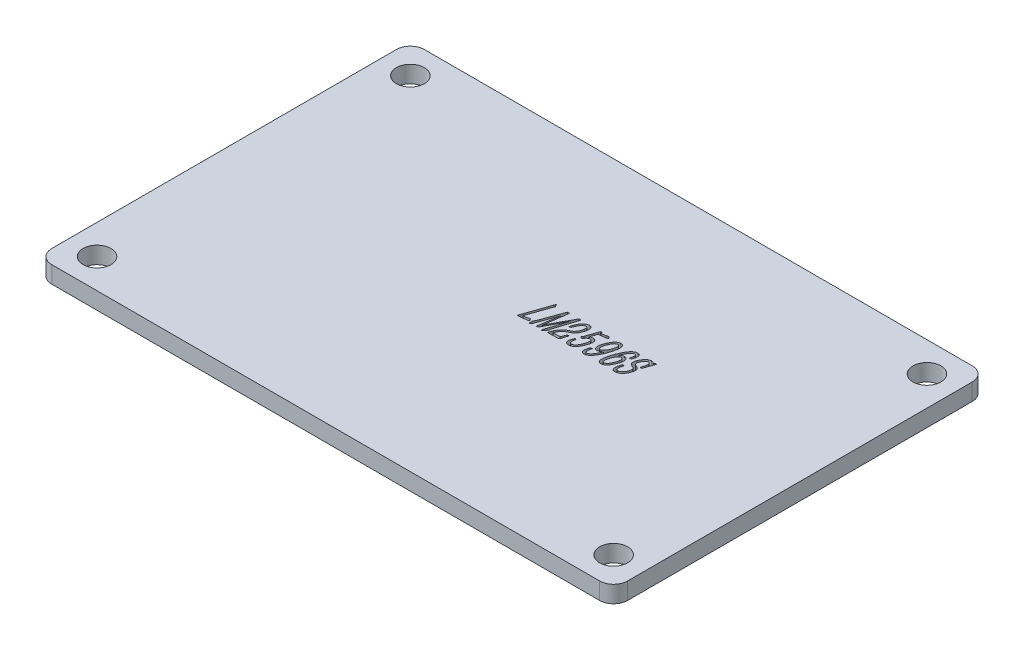
from build123d import *

# Parameters (mm, degrees)
SKETCH_1_R          = 1.65
EXTRUDE_1_DEPTH     = 2
CUT_EXTRUDE_START   = -1
CUT_EXTRUDE_1_DEPTH = 1


# Read off the part's stored shape, not the designer's step: 切除-拉伸1
with BuildPart() as part:
    # 草图1 → 凸台-拉伸1 (new body)
    with BuildSketch(Plane(origin=(0, 0, 0), x_dir=(1, 0, 0), z_dir=(0, 1, 0))):
        with BuildLine():
            Line((32.35, -22), (-32.35, -22))
            ThreePointArc((-32.35, -22), (-33.516726189, -21.516726189), (-34, -20.35))
            Line((-34, -20.35), (-34, 20.35))
            ThreePointArc((-34, 20.35), (-33.516726189, 21.516726189), (-32.35, 22))
            Line((-32.35, 22), (32.35, 22))
            ThreePointArc((32.35, 22), (33.516726189, 21.516726189), (34, 20.35))
            Line((34, 20.35), (34, -20.35))
            ThreePointArc((34, -20.35), (33.516726189, -21.516726189), (32.35, -22))
        make_face()
        with Locations(Location((-30.5, 18.5, 0), (0, 0, 270))):
            Circle(SKETCH_1_R, mode=Mode.SUBTRACT)
        with Locations(Location((30.5, 18.5, 0), (0, 0, 90))):
            Circle(SKETCH_1_R, mode=Mode.SUBTRACT)
        with Locations(Location((30.5, -18.5, 0), (0, 0, 270))):
            Circle(SKETCH_1_R, mode=Mode.SUBTRACT)
        with Locations(Location((-30.5, -18.5, 0), (0, 0, 90))):
            Circle(SKETCH_1_R, mode=Mode.SUBTRACT)
    extrude(amount=EXTRUDE_1_DEPTH)

    # 切除-拉伸1 outline → 切除-拉伸1 (cut)
    # profile 1 of 7: a face of its own
    with BuildSketch(Plane(origin=(0, 2, 0), x_dir=(1, 0, 0), z_dir=(0, 1, 0)).offset(CUT_EXTRUDE_START)):
        with BuildLine():
            add(Edge.make_bspline(
                [(11.319624973, 2.529725123), (11.326753338, 2.567830624), (11.339981513, 2.638543373), (11.363810052, 2.738810386), (11.386747264, 2.83309971), (11.402493277, 2.928406503), (11.408788686, 3.024022456), (11.40107061, 3.101456515), (11.384715065, 3.156938358), (11.369804851, 3.194089384), (11.348293758, 3.225207318), (11.322963493, 3.250684221), (11.294296694, 3.270288272), (11.263524636, 3.284015152), (11.230211949, 3.291074833), (11.184684427, 3.290006717), (11.129135658, 3.280496298), (11.076013715, 3.25837237), (11.034406929, 3.229718869), (10.996101664, 3.199008787), (10.95262477, 3.156252878), (10.901523079, 3.105345591), (10.847119389, 3.043543935), (10.792558439, 2.971198575), (10.736915044, 2.889534868), (10.664019856, 2.766635878), (10.576158329, 2.602847504), (10.499771775, 2.433051534), (10.445727973, 2.301323215), (10.421585689, 2.239116022), (10.410345271, 2.210525074)],
                knots=[0, 0, 0, 0, 0.048016888, 0.089105405, 0.127654772, 0.168210064, 0.208611881, 0.246125029, 0.263765638, 0.280183723, 0.295474126, 0.310282398, 0.324462469, 0.338252576, 0.351782306, 0.366256964, 0.394408992, 0.421179489, 0.436725185, 0.456877911, 0.481929832, 0.512200465, 0.546242109, 0.583815889, 0.624389886, 0.668597469, 0.76077153, 0.854490538, 0.899099648, 0.93715592, 0.93715592, 0.93715592, 0.93715592], degree=3))
            Line((11.319624973, 2.529725123), (11.486682293, 2.553590454))
            Line((11.486682293, 2.553590454), (11.542616663, 2.577455785))
            Line((11.542616663, 2.577455785), (11.59705945, 2.735563605))
            add(Edge.make_bspline(
                [(11.300980183, 3.558171745), (11.332938296, 3.55537961), (11.391604224, 3.55025405), (11.470752634, 3.530082967), (11.533066183, 3.499358127), (11.576123996, 3.457009642), (11.604543879, 3.412414193), (11.628279189, 3.371220088), (11.645918441, 3.332653625), (11.656575541, 3.294841352), (11.663922251, 3.255421395), (11.665904063, 3.210409655), (11.667264725, 3.158391127), (11.663279952, 3.101732242), (11.660194196, 3.045264039), (11.655589125, 2.993299452), (11.650667761, 2.948240187), (11.642153035, 2.894323663), (11.626748851, 2.823432882), (11.607663016, 2.766946106), (11.59705945, 2.735563605)],
                knots=[0, 0, 0, 0, 0.091586168, 0.168125935, 0.232336966, 0.287622003, 0.338278218, 0.383145194, 0.423552602, 0.459085297, 0.495189033, 0.537922916, 0.587673765, 0.643887342, 0.700141333, 0.749361491, 0.792995872, 0.829682411, 0.905376226, 1, 1, 1, 1], degree=3))
            add(Edge.make_bspline(
                [(10.078627743, 2.088962284), (10.092043775, 2.124514194), (10.117212009, 2.191208933), (10.152737815, 2.284990134), (10.185663794, 2.365405537), (10.225197569, 2.458460171), (10.279164702, 2.571015442), (10.346529938, 2.7098071), (10.422825779, 2.84851108), (10.4891655, 2.962189864), (10.547655064, 3.05014134), (10.597371436, 3.11763489), (10.654008389, 3.186987801), (10.714203242, 3.258491084), (10.779252353, 3.326433394), (10.846166624, 3.388282473), (10.915212273, 3.440367594), (10.984767437, 3.48551032), (11.058000786, 3.520567517), (11.135394035, 3.544224908), (11.216917438, 3.558489113), (11.272581603, 3.55827896), (11.300980183, 3.558171745)],
                knots=[0, 0, 0, 0, 0.056410835, 0.105825706, 0.14886341, 0.185400755, 0.255897094, 0.334127727, 0.414387224, 0.490842857, 0.529430594, 0.571134342, 0.615225599, 0.662339254, 0.709844425, 0.754777107, 0.797439761, 0.838085033, 0.877703722, 0.91750761, 0.957914275, 1, 1, 1, 1], degree=3))
            add(Edge.make_bspline(
                [(10.220328148, 0.281909227), (10.19249915, 0.280098745), (10.138454152, 0.276582721), (10.070837234, 0.287224422), (10.020300058, 0.307853057), (9.981584961, 0.329435729), (9.942445068, 0.358703245), (9.902806204, 0.393420868), (9.86591267, 0.435175841), (9.837901593, 0.485120934), (9.814521026, 0.539843172), (9.797351744, 0.623039326), (9.785413991, 0.73268396), (9.780797995, 0.847487699), (9.785600824, 0.948152915), (9.796865384, 1.037662616), (9.813201733, 1.140700776), (9.835695491, 1.251967632), (9.860700878, 1.361489032), (9.881452444, 1.45999998), (9.901360112, 1.541057249), (9.921795449, 1.627581379), (9.950036536, 1.724331764), (9.987162506, 1.839703457), (10.030604097, 1.961317245), (10.06209135, 2.045009175), (10.078627743, 2.088962284)],
                knots=[0, 0, 0, 0, 0.03956068, 0.07682838, 0.095843058, 0.116866224, 0.139607214, 0.165118082, 0.191658894, 0.218244295, 0.246111869, 0.275832629, 0.33841793, 0.402715898, 0.438774703, 0.481433334, 0.530775575, 0.586935239, 0.642621152, 0.690341085, 0.729908068, 0.761166336, 0.816603174, 0.872993246, 0.933298924, 1, 1, 1, 1], degree=3))
            add(Edge.make_bspline(
                [(11.068293203, 1.084380993), (11.053872372, 1.05541355), (11.023329038, 0.994060479), (10.969919402, 0.900045656), (10.909148123, 0.797266792), (10.842698841, 0.689580228), (10.77067729, 0.585020153), (10.689912589, 0.496193855), (10.604071033, 0.425272911), (10.514549478, 0.373835141), (10.428409541, 0.337241697), (10.350739054, 0.30914977), (10.282885658, 0.289066112), (10.239814747, 0.284138589), (10.220328148, 0.281909227)],
                knots=[0, 0, 0, 0, 0.079263847, 0.167880907, 0.264814542, 0.371790082, 0.477921398, 0.575347443, 0.664953156, 0.749565857, 0.827301008, 0.893958514, 0.952023584, 1, 1, 1, 1], degree=3))
            add(Edge.make_bspline(
                [(10.866929469, 2.42158534), (10.886589109, 2.42118425), (10.924292828, 2.420415029), (10.978317607, 2.413823439), (11.027127036, 2.402341257), (11.0704245, 2.384465457), (11.110126107, 2.363025804), (11.145250427, 2.334657677), (11.177822239, 2.301762803), (11.206196623, 2.262416031), (11.230840866, 2.217275717), (11.251560663, 2.166182107), (11.268932178, 2.109090825), (11.285125994, 2.024054569), (11.296537056, 1.911174741), (11.289262569, 1.794565371), (11.274634537, 1.697461188), (11.256960519, 1.617881049), (11.23389369, 1.53225165), (11.19483815, 1.411518301), (11.141690833, 1.260480826), (11.092451101, 1.142342016), (11.068293203, 1.084380993)],
                knots=[0, 0, 0, 0, 0.036382012, 0.069774277, 0.100580197, 0.128866596, 0.156266865, 0.183794371, 0.212106964, 0.241746136, 0.273258923, 0.307101626, 0.343643368, 0.383535045, 0.467197852, 0.552918689, 0.598998486, 0.648914818, 0.703726948, 0.763108811, 0.883776925, 1, 1, 1, 1], degree=3))
            add(Edge.make_bspline(
                [(10.410345271, 2.210525074), (10.416050186, 2.215819905), (10.449129723, 2.245792172), (10.515387249, 2.296635031), (10.596944633, 2.34739101), (10.669961017, 2.38141985), (10.730958103, 2.401452348), (10.797361446, 2.414729849), (10.843260597, 2.419252922), (10.866929469, 2.42158534)],
                knots=[0.404971471, 0.404971471, 0.404971471, 0.404971471, 0.432023627, 0.560128766, 0.694717093, 0.765101066, 0.83971451, 0.917345382, 1, 1, 1, 1], degree=3))
        make_face()
        with BuildLine():
            add(Edge.make_bspline(
                [(10.78340081, 2.144150863), (10.773100017, 2.142556458), (10.750618648, 2.139076688), (10.716027357, 2.124014401), (10.676728769, 2.104229335), (10.61950773, 2.068122267), (10.549209543, 2.014286204), (10.485947564, 1.949276583), (10.438225331, 1.889966685), (10.402168059, 1.836055129), (10.362124324, 1.775401551), (10.32250004, 1.70543497), (10.282350459, 1.628120598), (10.242879966, 1.544201096), (10.20537119, 1.453333549), (10.182767084, 1.390009052), (10.171105902, 1.35734072)],
                knots=[0, 0, 0, 0, 0.030109941, 0.065714622, 0.108588335, 0.157792871, 0.261597461, 0.364557771, 0.419941904, 0.482122806, 0.552499195, 0.630638236, 0.715103682, 0.805067532, 0.89943673, 1, 1, 1, 1], degree=3))
            add(Edge.make_bspline(
                [(10.994459834, 1.706371191), (10.996023434, 1.727987763), (10.999094338, 1.770442601), (10.998155227, 1.83301138), (10.993304701, 1.893197713), (10.982810117, 1.949506966), (10.969352689, 2.000724278), (10.95159455, 2.044118522), (10.930889814, 2.079967855), (10.905013561, 2.106412307), (10.876785311, 2.125274258), (10.847149319, 2.138714329), (10.815442897, 2.144403173), (10.79410278, 2.144235134), (10.78340081, 2.144150863)],
                knots=[0, 0, 0, 0, 0.117814531, 0.231387145, 0.339957123, 0.445764662, 0.542521874, 0.627383564, 0.700188791, 0.766158301, 0.826528991, 0.884046869, 0.941850039, 1, 1, 1, 1], degree=3))
            add(Edge.make_bspline(
                [(10.261346687, 0.559343703), (10.277116988, 0.561036132), (10.310050452, 0.564570469), (10.359697313, 0.581371719), (10.411370211, 0.606364875), (10.464387545, 0.639656708), (10.516258175, 0.68049559), (10.566448783, 0.725344467), (10.611522599, 0.776372283), (10.667831669, 0.851112799), (10.731329902, 0.95619793), (10.795934626, 1.094643622), (10.855107472, 1.241413379), (10.915663077, 1.390752272), (10.967307612, 1.545247184), (10.985397457, 1.652594138), (10.994459834, 1.706371191)],
                knots=[0, 0, 0, 0, 0.033065291, 0.069050969, 0.108790502, 0.152905102, 0.19956824, 0.246646067, 0.293375687, 0.341592316, 0.442107469, 0.549241177, 0.660589479, 0.772799957, 0.88618076, 1, 1, 1, 1], degree=3))
            add(Edge.make_bspline(
                [(10.171105902, 1.35734072), (10.157214891, 1.313537581), (10.128946777, 1.22439849), (10.099911739, 1.087160277), (10.082936778, 0.949425392), (10.081717538, 0.837543122), (10.089357472, 0.754881106), (10.09924336, 0.701098577), (10.115046922, 0.655622102), (10.133766577, 0.617106754), (10.158955138, 0.587815623), (10.18889873, 0.567377888), (10.224199621, 0.557126412), (10.248618264, 0.55858395), (10.261346687, 0.559343703)],
                knots=[0, 0, 0, 0, 0.152325287, 0.309980926, 0.464393534, 0.611968529, 0.679892627, 0.739554139, 0.792740957, 0.839202455, 0.880695047, 0.919337794, 0.957954149, 1, 1, 1, 1], degree=3))
        make_face(mode=Mode.SUBTRACT)
    # profile 2 of 7: a face of its own
    with BuildSketch(Plane(origin=(0, 2, 0), x_dir=(1, 0, 0), z_dir=(0, 1, 0)).offset(CUT_EXTRUDE_START)):
        with BuildLine():
            add(Edge.make_bspline(
                [(12.912635841, 3.567867036), (12.939142799, 3.565233706), (12.990134196, 3.560167972), (13.061479373, 3.539212889), (13.125736341, 3.511504093), (13.179321881, 3.472634465), (13.224573033, 3.431830655), (13.258620007, 3.394250591), (13.275885689, 3.369629077), (13.28190395, 3.359344784)],
                knots=[0, 0, 0, 0, 0.160913397, 0.309548871, 0.448301289, 0.582320695, 0.708056454, 0.8167907, 0.888918404, 0.888918404, 0.888918404, 0.888918404], degree=3))
            add(Edge.make_bspline(
                [(12.028872789, 2.730343064), (12.037961875, 2.756585471), (12.05554781, 2.807360352), (12.086989767, 2.878979592), (12.11750693, 2.945449357), (12.162163511, 3.025869263), (12.224268655, 3.12064819), (12.306016893, 3.227829835), (12.393614077, 3.323941803), (12.484290088, 3.405999762), (12.578963013, 3.471260438), (12.661240331, 3.516590821), (12.73159073, 3.543940104), (12.788797484, 3.557595487), (12.849411885, 3.567266944), (12.891215329, 3.567663723), (12.912635841, 3.567867036)],
                knots=[0, 0, 0, 0, 0.064498195, 0.12479374, 0.181637338, 0.234373753, 0.338350867, 0.444636662, 0.547250782, 0.640116115, 0.728083073, 0.81387459, 0.857749845, 0.902998931, 0.950295664, 1, 1, 1, 1], degree=3))
            add(Edge.make_bspline(
                [(12.213829107, 1.920413382), (12.18380199, 1.935425676), (12.124665966, 1.964991197), (12.061289845, 2.0182297), (12.019942917, 2.06725959), (11.994543204, 2.10732764), (11.973202676, 2.150129614), (11.957629324, 2.196825794), (11.947181788, 2.247139404), (11.942356007, 2.301149805), (11.941503127, 2.358766382), (11.94621769, 2.42089776), (11.956966845, 2.488708612), (11.974384709, 2.5631426), (11.998467725, 2.64475035), (12.018397516, 2.700854323), (12.028872789, 2.730343064)],
                knots=[0, 0, 0, 0, 0.107404064, 0.211523776, 0.262460483, 0.312661898, 0.363291962, 0.415479857, 0.470049255, 0.527721881, 0.589115285, 0.654664533, 0.727279933, 0.809086455, 0.899654161, 1, 1, 1, 1], degree=3))
            Line((12.213829107, 1.920413382), (12.398039633, 1.841359472))
            add(Edge.make_bspline(
                [(12.585233326, 1.240251438), (12.594400313, 1.274448647), (12.611296104, 1.33747796), (12.62795106, 1.425432934), (12.636008327, 1.498379763), (12.633269717, 1.558239262), (12.622779176, 1.608147262), (12.608581966, 1.652170455), (12.587575031, 1.690922305), (12.562719839, 1.726194961), (12.531116406, 1.757888149), (12.493380693, 1.787946863), (12.448445071, 1.816124798), (12.415345898, 1.832695368), (12.398039633, 1.841359472)],
                knots=[0, 0, 0, 0, 0.149796169, 0.276091238, 0.378589772, 0.459715849, 0.528429664, 0.593977199, 0.65469369, 0.714259707, 0.776015707, 0.843387247, 0.918113307, 1, 1, 1, 1], degree=3))
            add(Edge.make_bspline(
                [(11.931174089, 0.574259535), (11.95160895, 0.574956763), (11.991801323, 0.576328107), (12.050331783, 0.58771282), (12.10533799, 0.6066983), (12.15778136, 0.632425154), (12.207284117, 0.665796263), (12.256453349, 0.704089904), (12.304001843, 0.748899201), (12.363583365, 0.815241572), (12.430281098, 0.898970165), (12.494124356, 1.005113843), (12.545134858, 1.117985543), (12.571358469, 1.197945037), (12.585233326, 1.240251438)],
                knots=[0, 0, 0, 0, 0.06157663, 0.121112194, 0.178948509, 0.236604839, 0.296685232, 0.358612133, 0.424367126, 0.493341319, 0.627383728, 0.746417103, 0.865829817, 1, 1, 1, 1], degree=3))
            add(Edge.make_bspline(
                [(11.776795227, 1.46398892), (11.768461383, 1.425980908), (11.752797092, 1.354541058), (11.732683638, 1.253544708), (11.716322288, 1.165770154), (11.699399386, 1.069455772), (11.687113395, 0.964430817), (11.688733634, 0.867064956), (11.697142974, 0.79769926), (11.708995673, 0.75251395), (11.722406268, 0.711364334), (11.740619482, 0.675611471), (11.760390674, 0.644836582), (11.782109829, 0.620379129), (11.803881566, 0.600607911), (11.835200511, 0.58383917), (11.878312409, 0.573425255), (11.913231895, 0.573976366), (11.931174089, 0.574259535)],
                knots=[0, 0, 0, 0, 0.112864024, 0.212139198, 0.298694179, 0.371837857, 0.495825715, 0.604731979, 0.653479027, 0.698076056, 0.740035884, 0.7787337, 0.814133331, 0.845812142, 0.873421557, 0.898915982, 0.948061405, 1, 1, 1, 1], degree=3))
            Line((11.776795227, 1.46398892), (11.570956744, 1.46398892))
            Line((11.570956744, 1.46398892), (11.482207543, 1.151502237))
            add(Edge.make_bspline(
                [(11.846153846, 0.291604517), (11.821507506, 0.291672515), (11.774402182, 0.291802474), (11.707229629, 0.302668781), (11.647908365, 0.323792617), (11.596166803, 0.353871173), (11.552693807, 0.393226045), (11.514008461, 0.437883281), (11.483088935, 0.490364957), (11.45641734, 0.548064989), (11.437405549, 0.612114312), (11.425614494, 0.681715451), (11.420595756, 0.756164709), (11.423124823, 0.861840183), (11.43937617, 0.995682807), (11.468003001, 1.099826479), (11.482207543, 1.151502237)],
                knots=[0, 0, 0, 0, 0.066209553, 0.126543031, 0.181941951, 0.234679622, 0.286308345, 0.338948483, 0.392946326, 0.449486953, 0.509545765, 0.57196873, 0.638979959, 0.709851081, 0.856029028, 1, 1, 1, 1], degree=3))
            add(Edge.make_bspline(
                [(12.716492649, 0.886746218), (12.690673631, 0.843535161), (12.639155802, 0.757314228), (12.560012956, 0.660765442), (12.494157344, 0.590048647), (12.446439371, 0.542235389), (12.400473609, 0.499550612), (12.354670103, 0.462173232), (12.307160045, 0.427820804), (12.25390394, 0.397983566), (12.195658355, 0.36856258), (12.132248815, 0.342013207), (12.064574224, 0.319473968), (11.993939972, 0.303210907), (11.920780395, 0.293064213), (11.871295667, 0.292096292), (11.846153846, 0.291604517)],
                knots=[0, 0, 0, 0, 0.136340092, 0.272045418, 0.337393071, 0.398407192, 0.455181305, 0.507402547, 0.558653188, 0.613922574, 0.672710074, 0.735558621, 0.800150866, 0.865886795, 0.931860792, 1, 1, 1, 1], degree=3))
            add(Edge.make_bspline(
                [(12.603878116, 2.121777115), (12.625624731, 2.110055924), (12.666928449, 2.087793665), (12.723661478, 2.052989545), (12.771789988, 2.018606704), (12.823834543, 1.974915948), (12.876279106, 1.915606015), (12.913094756, 1.847682595), (12.93267358, 1.790038621), (12.943825739, 1.74470064), (12.947642368, 1.696750531), (12.947439011, 1.629122814), (12.93803875, 1.540489915), (12.922539072, 1.449199842), (12.903377024, 1.372394865), (12.887292499, 1.308688575), (12.865934129, 1.241147333), (12.835749131, 1.144635294), (12.79080682, 1.023351055), (12.741226002, 0.932211244), (12.716492649, 0.886746218)],
                knots=[0, 0, 0, 0, 0.051978856, 0.098724335, 0.139954766, 0.176325786, 0.241579757, 0.305248117, 0.337342347, 0.369572714, 0.403199264, 0.438248371, 0.511800373, 0.590407898, 0.632912887, 0.678337143, 0.72864387, 0.781914954, 0.891208439, 1, 1, 1, 1], degree=3))
            Line((12.603878116, 2.121777115), (12.451736629, 2.191881526))
            add(Edge.make_bspline(
                [(12.251864479, 2.420839548), (12.25546024, 2.402259087), (12.262116354, 2.367864795), (12.280672021, 2.321957054), (12.302840436, 2.284124567), (12.341964771, 2.250166174), (12.392119568, 2.220779682), (12.432728901, 2.201095135), (12.451736629, 2.191881526)],
                knots=[0, 0, 0, 0, 0.175867707, 0.325548712, 0.459851584, 0.579514817, 0.803186428, 1, 1, 1, 1], degree=3))
            add(Edge.make_bspline(
                [(12.827615598, 3.290432559), (12.817908102, 3.289873934), (12.796811475, 3.288659913), (12.768800737, 3.283484538), (12.742880056, 3.273587179), (12.717635925, 3.261203579), (12.687516093, 3.243071278), (12.638434899, 3.211799257), (12.573729795, 3.160269146), (12.503974029, 3.081081866), (12.440608573, 2.992377615), (12.393744172, 2.913555877), (12.361985839, 2.845783376), (12.33736252, 2.789834611), (12.312076152, 2.727980931), (12.287128503, 2.662429917), (12.266514629, 2.596339869), (12.252249856, 2.533358423), (12.24732849, 2.475025625), (12.250408657, 2.438230529), (12.251864479, 2.420839548)],
                knots=[0, 0, 0, 0, 0.02615902, 0.056849589, 0.07610501, 0.100631584, 0.132403363, 0.17061691, 0.257201114, 0.353786648, 0.453453338, 0.550260886, 0.599916659, 0.654714876, 0.714699339, 0.779666327, 0.843339964, 0.900791803, 0.953109843, 1, 1, 1, 1], degree=3))
            add(Edge.make_bspline(
                [(13.052844662, 2.761666312), (13.058173498, 2.789455577), (13.067940833, 2.840391112), (13.076337384, 2.910439693), (13.082173791, 2.966656911), (13.080289229, 3.022987276), (13.06815402, 3.08223188), (13.044263646, 3.146477292), (13.006166289, 3.203274921), (12.955389906, 3.248171568), (12.895185746, 3.281983749), (12.850160063, 3.287613653), (12.827615598, 3.290432559)],
                knots=[0, 0, 0, 0, 0.128213972, 0.235006107, 0.319796701, 0.384071856, 0.489716169, 0.592471914, 0.693117255, 0.796064391, 0.897888965, 1, 1, 1, 1], degree=3))
            Line((13.052844662, 2.761666312), (12.895482634, 2.19859365))
            Line((12.895482634, 2.19859365), (13.099083742, 2.211272107))
            Line((13.099083742, 2.211272107), (13.553270829, 3.524611123))
            Line((13.553270829, 3.524611123), (13.373535052, 3.539526955))
            Line((13.373535052, 3.539526955), (13.28190395, 3.359344784))
        make_face()
    # profile 3 of 7: a face of its own
    with BuildSketch(Plane(origin=(0, 2, 0), x_dir=(1, 0, 0), z_dir=(0, 1, 0)).offset(CUT_EXTRUDE_START)):
        with BuildLine():
            add(Edge.make_bspline(
                [(4.518751332, 2.1941189), (4.52742417, 2.224704013), (4.543586905, 2.281702542), (4.56654992, 2.361132264), (4.587435472, 2.42793498), (4.611929362, 2.503501881), (4.646526277, 2.594316086), (4.67664378, 2.666295228), (4.692520776, 2.704240358)],
                knots=[0, 0, 0, 0, 0.176806308, 0.329496897, 0.459810584, 0.566052454, 0.77123656, 1, 1, 1, 1], degree=3))
            Line((4.518751332, 2.1941189), (4.694012359, 2.217984232))
            Line((4.694012359, 2.217984232), (4.748455146, 2.241103772))
            Line((4.748455146, 2.241103772), (4.808118474, 2.402194758))
            add(Edge.make_bspline(
                [(5.501704667, 3.241210313), (5.482379308, 3.240757185), (5.439944116, 3.239762191), (5.374292699, 3.21333138), (5.303012143, 3.170582731), (5.227738787, 3.109611004), (5.150875726, 3.032289377), (5.078006004, 2.936860027), (5.006798145, 2.824648378), (4.936411066, 2.696335254), (4.86826172, 2.554061095), (4.828402329, 2.453413057), (4.808118474, 2.402194758)],
                knots=[0, 0, 0, 0, 0.050563255, 0.111028292, 0.18322451, 0.269416453, 0.365243966, 0.469747148, 0.584883573, 0.714985691, 0.85496043, 1, 1, 1, 1], degree=3))
            add(Edge.make_bspline(
                [(5.700085233, 2.843703388), (5.702760308, 2.870021391), (5.707874552, 2.920336507), (5.70832801, 2.99333408), (5.700560048, 3.059541133), (5.688387067, 3.11918998), (5.665665647, 3.172021345), (5.623381091, 3.210604938), (5.567076911, 3.234856875), (5.524595988, 3.238985537), (5.501704667, 3.241210313)],
                knots=[0, 0, 0, 0, 0.154058382, 0.294530913, 0.424229108, 0.541566664, 0.649092709, 0.752563447, 0.866666044, 1, 1, 1, 1], degree=3))
            add(Edge.make_bspline(
                [(5.119113573, 1.891327509), (5.137899638, 1.901021344), (5.174046093, 1.919673349), (5.223813272, 1.950516435), (5.268579282, 1.980772805), (5.308239823, 2.014571505), (5.347364494, 2.053553536), (5.387403985, 2.102337589), (5.429373945, 2.162612276), (5.490308836, 2.254276533), (5.559846289, 2.376167772), (5.624751363, 2.528763989), (5.6732433, 2.683894653), (5.691103931, 2.790231434), (5.700085233, 2.843703388)],
                knots=[0, 0, 0, 0, 0.05476668, 0.105377116, 0.151669174, 0.194650271, 0.240210143, 0.294657526, 0.357948043, 0.430501334, 0.579948825, 0.72081211, 0.859609046, 1, 1, 1, 1], degree=3))
            Line((5.119113573, 1.891327509), (4.873002344, 1.763051353))
            add(Edge.make_bspline(
                [(4.026528873, 0.838269763), (4.053436719, 0.893321497), (4.104223711, 0.99722844), (4.186161234, 1.13827915), (4.266099643, 1.256681798), (4.346582779, 1.351995827), (4.424112839, 1.429631638), (4.494949772, 1.497370541), (4.560862148, 1.554686162), (4.642469506, 1.617984485), (4.745186989, 1.687597609), (4.829968468, 1.737646995), (4.873002344, 1.763051353)],
                knots=[0, 0, 0, 0, 0.143839333, 0.271488367, 0.382722806, 0.478837322, 0.563869028, 0.640256739, 0.708952998, 0.768852387, 0.882672751, 1, 1, 1, 1], degree=3))
            add(Edge.make_bspline(
                [(3.969848711, 0.331131472), (3.958861911, 0.330771559), (3.939028006, 0.330121826), (3.912017273, 0.337515829), (3.891466092, 0.352157542), (3.880298429, 0.376235534), (3.878830794, 0.407793192), (3.882801393, 0.448523238), (3.89595605, 0.499146405), (3.921493786, 0.582842534), (3.965870906, 0.697211517), (4.00584785, 0.790176677), (4.026528873, 0.838269763)],
                knots=[0, 0, 0, 0, 0.055062309, 0.09940116, 0.138686278, 0.177851686, 0.228145004, 0.295993015, 0.383390618, 0.490642207, 0.736497112, 1, 1, 1, 1], degree=3))
            Line((3.969848711, 0.331131472), (4.955785212, 0.355742595))
            add(Edge.make_bspline(
                [(5.265288728, 0.553377371), (5.261278348, 0.539966515), (5.254294301, 0.516611612), (5.245518009, 0.485792342), (5.238170034, 0.465080135), (5.231479678, 0.446252079), (5.213569852, 0.425065122), (5.193249486, 0.396911338), (5.156182621, 0.373587741), (5.105742147, 0.364690038), (5.037665859, 0.35589756), (4.98518622, 0.355798239), (4.955785212, 0.355742595)],
                knots=[0, 0, 0, 0, 0.100483591, 0.174991401, 0.22972114, 0.258544779, 0.317448375, 0.426207677, 0.506394728, 0.62409379, 0.789403632, 1, 1, 1, 1], degree=3))
            Line((5.265288728, 0.553377371), (5.480822502, 1.251438312))
            Line((5.480822502, 1.251438312), (5.273492436, 1.251438312))
            Line((5.273492436, 1.251438312), (5.091519284, 0.786064351))
            add(Edge.make_bspline(
                [(5.012465374, 0.642872363), (5.015280268, 0.643394819), (5.020563987, 0.6443755), (5.028521261, 0.650370967), (5.034430882, 0.666113687), (5.04811039, 0.691825755), (5.067938047, 0.733654665), (5.082897328, 0.766901914), (5.091519284, 0.786064351)],
                knots=[0, 0, 0, 0, 0.050886524, 0.095516957, 0.171388695, 0.345046395, 0.622509892, 1, 1, 1, 1], degree=3))
            Line((5.012465374, 0.642872363), (4.21595994, 0.614532282))
            Line((4.21595994, 0.614532282), (4.280098018, 0.772640102))
            add(Edge.make_bspline(
                [(4.915512465, 1.508736416), (4.886179417, 1.492742657), (4.827048838, 1.460501882), (4.742868179, 1.40457342), (4.662415969, 1.34381028), (4.591968595, 1.273672462), (4.528541807, 1.198981821), (4.468398884, 1.120471794), (4.412177336, 1.03414168), (4.359633601, 0.943454614), (4.313400772, 0.85614754), (4.29038255, 0.798428807), (4.280098018, 0.772640102)],
                knots=[0, 0, 0, 0, 0.100736605, 0.203068347, 0.304619499, 0.404315168, 0.502166149, 0.60010617, 0.702437912, 0.812664409, 0.91629854, 1, 1, 1, 1], degree=3))
            Line((4.915512465, 1.508736416), (5.22427019, 1.668335819))
            add(Edge.make_bspline(
                [(5.814191349, 2.308970808), (5.791326086, 2.265279153), (5.74440479, 2.175620482), (5.660051753, 2.049790865), (5.569560284, 1.933450682), (5.486922509, 1.848915338), (5.415063521, 1.792483145), (5.357403798, 1.750233432), (5.293240909, 1.7087072), (5.247746119, 1.68207724), (5.22427019, 1.668335819)],
                knots=[0, 0, 0, 0, 0.166927441, 0.34254808, 0.512188802, 0.665802747, 0.741285181, 0.821454804, 0.907868257, 1, 1, 1, 1], degree=3))
            add(Edge.make_bspline(
                [(5.599403367, 3.538781163), (5.621606813, 3.537117835), (5.664163567, 3.533929778), (5.724784762, 3.520095975), (5.77974091, 3.500313212), (5.828236662, 3.473041702), (5.871005934, 3.441647552), (5.907828012, 3.406681898), (5.938077474, 3.367773107), (5.963172818, 3.325862973), (5.98165253, 3.278828985), (5.996994737, 3.227832865), (6.005073695, 3.171067425), (6.012231251, 3.090010012), (6.009783094, 2.984777885), (5.991678271, 2.856561809), (5.960244821, 2.722605303), (5.919428998, 2.582902167), (5.872535809, 2.44222348), (5.833237055, 2.352469217), (5.814191349, 2.308970808)],
                knots=[0, 0, 0, 0, 0.044636197, 0.085553007, 0.124390622, 0.161466956, 0.196796398, 0.230676006, 0.263017811, 0.295451868, 0.328347086, 0.364194254, 0.402094164, 0.443159791, 0.527501624, 0.612607545, 0.702668551, 0.803424088, 0.90473166, 1, 1, 1, 1], degree=3))
            add(Edge.make_bspline(
                [(4.692520776, 2.704240358), (4.704829383, 2.733376157), (4.728738936, 2.789972648), (4.765412737, 2.871250639), (4.804124408, 2.945167471), (4.842430538, 3.015645801), (4.887979964, 3.083425056), (4.941301867, 3.153346275), (5.005153812, 3.226019045), (5.075500384, 3.300468462), (5.149721381, 3.37039397), (5.225927168, 3.427121407), (5.299901943, 3.471287233), (5.372992327, 3.498431741), (5.440596807, 3.514994961), (5.500260261, 3.529354022), (5.552450691, 3.537226083), (5.58471661, 3.538294735), (5.599403367, 3.538781163)],
                knots=[0, 0, 0, 0, 0.072714776, 0.141248954, 0.204893109, 0.264509684, 0.325534037, 0.392401429, 0.466539591, 0.547790467, 0.627869174, 0.700563736, 0.765849414, 0.825180425, 0.878964782, 0.925827397, 0.966238217, 1, 1, 1, 1], degree=3))
        make_face()
    # profile 4 of 7: a face of its own
    with BuildSketch(Plane(origin=(0, 2, 0), x_dir=(1, 0, 0), z_dir=(0, 1, 0)).offset(CUT_EXTRUDE_START)):
        with BuildLine():
            add(Edge.make_bspline(
                [(3.759535478, 1.011293416), (3.754922021, 0.998411394), (3.74635742, 0.974496709), (3.736445384, 0.940605878), (3.726816458, 0.912364054), (3.719112619, 0.881013608), (3.713109845, 0.845126386), (3.707546363, 0.804614334), (3.706058766, 0.766926656), (3.707628046, 0.734019354), (3.710731277, 0.705928575), (3.710755684, 0.681837677), (3.700151773, 0.65791386), (3.682268159, 0.628493151), (3.65475747, 0.586082516), (3.632149433, 0.554268415), (3.619326657, 0.536224164)],
                knots=[0, 0, 0, 0, 0.080753431, 0.149913804, 0.20839393, 0.25679974, 0.340280675, 0.42310116, 0.498002039, 0.562639444, 0.617115751, 0.66563266, 0.701877649, 0.769590465, 0.869316836, 1, 1, 1, 1], degree=3))
            Line((3.759535478, 1.011293416), (3.828894098, 1.229064564))
            Line((3.828894098, 1.229064564), (4.577668869, 3.593969742))
            Line((4.577668869, 3.593969742), (4.332303431, 3.593969742))
            Line((4.332303431, 3.593969742), (2.815363307, 0.797251225))
            Line((2.815363307, 0.797251225), (3.200191775, 3.593969742))
            Line((3.200191775, 3.593969742), (2.951097379, 3.593969742))
            Line((2.951097379, 3.593969742), (2.087470701, 1.20370765))
            add(Edge.make_bspline(
                [(1.799595142, 0.566055828), (1.801478516, 0.581109529), (1.805173922, 0.610646704), (1.821543585, 0.653578281), (1.845429282, 0.696107861), (1.875545933, 0.736707605), (1.901000571, 0.773152741), (1.921166344, 0.796774711), (1.931063669, 0.815674908), (1.941339048, 0.833170877), (1.950847183, 0.858589935), (1.964007402, 0.887240928), (1.975192454, 0.917106232), (1.986828891, 0.942058714), (1.994834316, 0.961643085), (2.000845452, 0.975295176), (2.006468186, 0.986958971), (2.010972758, 1.001370544), (2.020147647, 1.020673065), (2.028983008, 1.046375699), (2.040498312, 1.077755243), (2.054689916, 1.114356101), (2.070250625, 1.157244706), (2.081484634, 1.187556135), (2.087470701, 1.20370765)],
                knots=[0, 0, 0, 0, 0.064362733, 0.126287432, 0.194015174, 0.271510944, 0.341137925, 0.383462597, 0.40288704, 0.431768008, 0.469698212, 0.518048477, 0.565991795, 0.60531333, 0.635185225, 0.656027709, 0.668812983, 0.690238215, 0.72011011, 0.759616287, 0.805811297, 0.862408184, 0.926683881, 1, 1, 1, 1], degree=3))
            Line((1.799595142, 0.566055828), (1.811527807, 0.348284679))
            add(Edge.make_bspline(
                [(1.857766887, 0.198380567), (1.851709489, 0.199225064), (1.838525031, 0.201063186), (1.822736888, 0.211024146), (1.814233273, 0.226009088), (1.80992754, 0.242607416), (1.808149201, 0.263963083), (1.808153466, 0.288405989), (1.810231987, 0.311719688), (1.8103767, 0.330155913), (1.811603477, 0.341561625), (1.811544602, 0.346792507), (1.811527807, 0.348284679)],
                knots=[0, 0, 0, 0, 0.103457675, 0.225184737, 0.299006802, 0.391175757, 0.514212532, 0.661916962, 0.805649294, 0.911236827, 0.974679241, 1, 1, 1, 1], degree=3))
            add(Edge.make_bspline(
                [(2.066588536, 0.401981675), (2.057289988, 0.378448997), (2.038176198, 0.330075993), (2.007974543, 0.272172839), (1.975065965, 0.230566669), (1.9416431, 0.209155613), (1.901537391, 0.197425234), (1.873012571, 0.198047815), (1.857766887, 0.198380567)],
                knots=[0, 0, 0, 0, 0.238225779, 0.489689114, 0.612577651, 0.732692637, 0.85713202, 1, 1, 1, 1], degree=3))
            Line((2.066588536, 0.401981675), (2.181440443, 0.707756233))
            Line((2.181440443, 0.707756233), (2.933198381, 2.796718517))
            Line((2.933198381, 2.796718517), (2.552098871, 0.322927765))
            Line((2.552098871, 0.322927765), (2.76539527, 0.31621564))
            Line((2.76539527, 0.31621564), (4.072767952, 2.826550181))
            Line((4.072767952, 2.826550181), (3.391860217, 0.733113147))
            Line((3.391860217, 0.733113147), (3.2956531, 0.427338589))
            add(Edge.make_bspline(
                [(3.244939271, 0.252077562), (3.244076606, 0.259799804), (3.241797935, 0.280197582), (3.251889389, 0.317902753), (3.270134432, 0.368247272), (3.286452101, 0.406032651), (3.2956531, 0.427338589)],
                knots=[0, 0, 0, 0, 0.125565402, 0.331672527, 0.62315202, 1, 1, 1, 1], degree=3))
            add(Edge.make_bspline(
                [(3.505966333, 0.367675261), (3.494455365, 0.352371298), (3.473086616, 0.323961301), (3.441222414, 0.286856075), (3.413111385, 0.257719643), (3.380532249, 0.232438728), (3.340231313, 0.213403669), (3.298816062, 0.211295154), (3.271163782, 0.218107417), (3.255222616, 0.225191195), (3.245742075, 0.237650105), (3.245209847, 0.24721496), (3.244939271, 0.252077562)],
                knots=[0, 0, 0, 0, 0.167159473, 0.310311779, 0.426966479, 0.519877317, 0.66953105, 0.808609623, 0.871260354, 0.917867672, 0.958245383, 1, 1, 1, 1], degree=3))
            Line((3.505966333, 0.367675261), (3.619326657, 0.536224164))
        make_face()
    # profile 5 of 7: a face of its own
    with BuildSketch(Plane(origin=(0, 2, 0), x_dir=(1, 0, 0), z_dir=(0, 1, 0)).offset(CUT_EXTRUDE_START)):
        with BuildLine():
            add(Edge.make_bspline(
                [(8.173130194, 1.330492222), (8.166894798, 1.308621546), (8.155069895, 1.267145657), (8.138549738, 1.208008235), (8.124438148, 1.155602287), (8.108655453, 1.092787365), (8.094295896, 1.01296145), (8.080777408, 0.913586682), (8.079345091, 0.811612797), (8.09436686, 0.730672762), (8.11429414, 0.673670829), (8.132475538, 0.637579853), (8.152126106, 0.606758143), (8.175038714, 0.581792848), (8.201963299, 0.56321907), (8.232933859, 0.551493521), (8.267583981, 0.545446051), (8.318167708, 0.546039829), (8.382422177, 0.559227076), (8.445312536, 0.58461919), (8.495638299, 0.616263735), (8.537811208, 0.651702113), (8.586463067, 0.695589767), (8.639578203, 0.749800444), (8.695930399, 0.813291133), (8.752541297, 0.886492586), (8.808448958, 0.969303025), (8.88490698, 1.093203941), (8.976387241, 1.264043175), (9.040871557, 1.407885921), (9.074046452, 1.481887918)],
                knots=[0, 0, 0, 0, 0.031366226, 0.059483398, 0.084683528, 0.106221462, 0.148788073, 0.196461362, 0.24446272, 0.288777514, 0.309165842, 0.327566008, 0.344397941, 0.359437255, 0.373987904, 0.38907794, 0.404748868, 0.422235077, 0.458546602, 0.494521488, 0.515164806, 0.540278486, 0.570376649, 0.605531788, 0.644882388, 0.687403406, 0.733051076, 0.782624689, 0.888168104, 1, 1, 1, 1], degree=3))
            Line((8.173130194, 1.330492222), (8.052311954, 1.306626891))
            Line((8.052311954, 1.306626891), (7.948646921, 1.28276156))
            Line((7.948646921, 1.28276156), (7.912103132, 1.178350735))
            add(Edge.make_bspline(
                [(8.181333902, 0.286383976), (8.160873666, 0.287822735), (8.121073492, 0.290621473), (8.063836046, 0.303910993), (8.010486217, 0.322243319), (7.961800028, 0.347319489), (7.91916732, 0.379912558), (7.883330414, 0.419807162), (7.856737613, 0.46805384), (7.836253817, 0.522255179), (7.824358058, 0.583244383), (7.817712204, 0.649658727), (7.817279749, 0.721767588), (7.822556648, 0.799812335), (7.834986598, 0.884454896), (7.853510647, 0.976180713), (7.880369844, 1.07491894), (7.901215147, 1.142862327), (7.912103132, 1.178350735)],
                knots=[0, 0, 0, 0, 0.055007551, 0.107003176, 0.15725938, 0.206235332, 0.253374724, 0.300669887, 0.349115068, 0.400455005, 0.455713199, 0.515437444, 0.579535696, 0.649128809, 0.725326228, 0.809126768, 0.900302481, 1, 1, 1, 1], degree=3))
            add(Edge.make_bspline(
                [(9.461858087, 1.745898146), (9.437367071, 1.686682548), (9.390532213, 1.573442898), (9.321311486, 1.411437627), (9.25371891, 1.264199023), (9.18657859, 1.127125985), (9.11420762, 0.995163941), (9.032593366, 0.862601406), (8.935141185, 0.726523616), (8.840844669, 0.614405932), (8.758924109, 0.527647508), (8.696631832, 0.470249327), (8.634993239, 0.422182706), (8.573617605, 0.384154216), (8.514321783, 0.354365245), (8.458174476, 0.330513933), (8.405641947, 0.311218653), (8.341350994, 0.296181818), (8.266947717, 0.286024043), (8.208956603, 0.286267846), (8.181333902, 0.286383976)],
                knots=[0, 0, 0, 0, 0.0933016, 0.17842327, 0.256488765, 0.329170216, 0.400608986, 0.475541244, 0.555697532, 0.644076035, 0.68862185, 0.729356176, 0.767292738, 0.802245569, 0.834296723, 0.863811269, 0.891056859, 0.915638031, 0.959816163, 1, 1, 1, 1], degree=3))
            add(Edge.make_bspline(
                [(9.261240145, 3.553696996), (9.291138462, 3.554025011), (9.350785323, 3.5546794), (9.424880873, 3.539360924), (9.482508723, 3.517729969), (9.526098291, 3.494465131), (9.56876625, 3.463128103), (9.61086121, 3.425764639), (9.649914849, 3.381452303), (9.681751898, 3.329112684), (9.704592363, 3.26961564), (9.724152634, 3.183128611), (9.738488832, 3.072680666), (9.745098542, 2.960108041), (9.742249078, 2.864130153), (9.732826633, 2.77917685), (9.715901538, 2.680496764), (9.693248522, 2.573330173), (9.670112114, 2.467114322), (9.646931591, 2.372205518), (9.629208759, 2.292556291), (9.606245605, 2.205930361), (9.578594449, 2.101941398), (9.53923425, 1.978320367), (9.500013852, 1.858059652), (9.473859278, 1.781176478), (9.461858087, 1.745898146)],
                knots=[0, 0, 0, 0, 0.042022022, 0.083833538, 0.105549425, 0.128571957, 0.153152048, 0.179927571, 0.207722664, 0.236000768, 0.265709669, 0.297040815, 0.360659025, 0.422352577, 0.455626199, 0.495755141, 0.542602333, 0.596566009, 0.649991039, 0.695674037, 0.734140798, 0.764877626, 0.821863417, 0.885642275, 0.947526234, 1, 1, 1, 1], degree=3))
            add(Edge.make_bspline(
                [(8.456531004, 2.749733646), (8.470433832, 2.779943736), (8.499726641, 2.843595419), (8.551332059, 2.940867705), (8.612240745, 3.044580335), (8.679126695, 3.152026305), (8.750978569, 3.255109631), (8.829535094, 3.342667997), (8.911181915, 3.411962012), (8.995270404, 3.461574867), (9.075103662, 3.496427649), (9.14546809, 3.524845689), (9.206232133, 3.544396743), (9.244253219, 3.550825001), (9.261240145, 3.553696996)],
                knots=[0, 0, 0, 0, 0.083885869, 0.176744809, 0.277642808, 0.38726805, 0.496045028, 0.594174218, 0.683227605, 0.765079589, 0.839459132, 0.902815481, 0.956580247, 1, 1, 1, 1], degree=3))
            add(Edge.make_bspline(
                [(8.610909866, 1.413275091), (8.594485581, 1.41285115), (8.562781652, 1.412032813), (8.516562708, 1.417782566), (8.473321608, 1.42695778), (8.432972392, 1.44204883), (8.396291169, 1.463059673), (8.363075709, 1.489688073), (8.332863569, 1.521450112), (8.305870018, 1.559003683), (8.282817865, 1.603072118), (8.26250992, 1.653200989), (8.24693093, 1.710212856), (8.227025204, 1.794493707), (8.217152881, 1.908292193), (8.22187555, 2.025885128), (8.236809369, 2.124525427), (8.255157321, 2.205553089), (8.278870393, 2.29304319), (8.320333611, 2.41623638), (8.376573598, 2.570684709), (8.430235664, 2.690850386), (8.456531004, 2.749733646)],
                knots=[0, 0, 0, 0, 0.030771132, 0.059397762, 0.087109985, 0.113520958, 0.139832982, 0.166045684, 0.193086983, 0.221812155, 0.252473599, 0.286152009, 0.323040145, 0.363192746, 0.44846046, 0.536190887, 0.583335406, 0.63537169, 0.691923975, 0.753257496, 0.879091906, 1, 1, 1, 1], degree=3))
            add(Edge.make_bspline(
                [(9.136890995, 1.646380366), (9.128273617, 1.638364452), (9.090597837, 1.604511853), (9.013007861, 1.547674573), (8.920495885, 1.491185326), (8.835608513, 1.449990518), (8.764355334, 1.42888271), (8.688951784, 1.41585164), (8.637316399, 1.414146901), (8.610909866, 1.413275091)],
                knots=[0.363117038, 0.363117038, 0.363117038, 0.363117038, 0.401280353, 0.527386702, 0.674240667, 0.752518812, 0.832607357, 0.914394762, 1, 1, 1, 1], degree=3))
            Line((9.136890995, 1.646380366), (9.074046452, 1.481887918))
        make_face()
        with BuildLine():
            add(Edge.make_bspline(
                [(8.697421692, 1.695930109), (8.714176462, 1.697072693), (8.747946121, 1.699375599), (8.797394202, 1.713930638), (8.8464683, 1.733892593), (8.909797282, 1.771532487), (8.983452766, 1.828610971), (9.049809013, 1.895868999), (9.098060351, 1.957422705), (9.134985952, 2.010622343), (9.174049025, 2.069491243), (9.213683412, 2.135629352), (9.254151226, 2.20907723), (9.292667627, 2.291395835), (9.330063091, 2.382050706), (9.352988032, 2.445847567), (9.364905178, 2.479011293)],
                knots=[0, 0, 0, 0, 0.046456241, 0.093633721, 0.142172609, 0.193153439, 0.297430293, 0.399838747, 0.45433643, 0.514222566, 0.579445749, 0.650289212, 0.728057789, 0.8119654, 0.902253372, 1, 1, 1, 1], degree=3))
            add(Edge.make_bspline(
                [(8.525889623, 2.133709781), (8.522621874, 2.109136346), (8.51633529, 2.0618613), (8.515802205, 1.992492178), (8.517514349, 1.927733207), (8.527748379, 1.868691581), (8.540557059, 1.817241024), (8.555996153, 1.774751983), (8.573394231, 1.742192943), (8.593348917, 1.71861724), (8.616802933, 1.704857186), (8.641459545, 1.695476881), (8.669113048, 1.692685913), (8.687746903, 1.694821369), (8.697421692, 1.695930109)],
                knots=[0, 0, 0, 0, 0.137461551, 0.26445229, 0.384639823, 0.496488605, 0.596231786, 0.678767345, 0.746724861, 0.80047436, 0.847576929, 0.89603467, 0.946020688, 1, 1, 1, 1], degree=3))
            add(Edge.make_bspline(
                [(9.21723844, 3.275516727), (9.205462137, 3.273927091), (9.179545898, 3.270428762), (9.139465994, 3.255265779), (9.094906746, 3.232245043), (9.047153223, 3.201633835), (8.998278512, 3.164196813), (8.952230684, 3.119819253), (8.908277534, 3.070319291), (8.853901525, 2.993099084), (8.788747427, 2.882144525), (8.717465973, 2.736317038), (8.652678822, 2.584540792), (8.600974319, 2.460695719), (8.566336391, 2.363652579), (8.548263076, 2.289070078), (8.533569045, 2.212455177), (8.528465037, 2.160118275), (8.525889623, 2.133709781)],
                knots=[0, 0, 0, 0, 0.02540677, 0.05591296, 0.091185471, 0.132874853, 0.177323725, 0.222933041, 0.26975595, 0.319005709, 0.42511269, 0.545228092, 0.666704705, 0.778825168, 0.832922238, 0.887335982, 0.943151256, 1, 1, 1, 1], degree=3))
            add(Edge.make_bspline(
                [(9.364905178, 2.479011293), (9.378383272, 2.52130362), (9.405119034, 2.605196606), (9.430914601, 2.734147463), (9.444920711, 2.863688443), (9.4443016, 2.971327557), (9.43472618, 3.053993014), (9.422766074, 3.110126888), (9.403618496, 3.15942345), (9.380251293, 3.202291085), (9.350666944, 3.23810513), (9.311894734, 3.261941684), (9.266682891, 3.276037616), (9.234251607, 3.275695958), (9.21723844, 3.275516727)],
                knots=[0, 0, 0, 0, 0.143199211, 0.284056478, 0.423636956, 0.563279705, 0.630368189, 0.692081822, 0.74796889, 0.800426307, 0.849345391, 0.895876061, 0.945377496, 1, 1, 1, 1], degree=3))
        make_face(mode=Mode.SUBTRACT)
    # profile 6 of 7: a face of its own
    with BuildSketch(Plane(origin=(0, 2, 0), x_dir=(1, 0, 0), z_dir=(0, 1, 0)).offset(CUT_EXTRUDE_START)):
        with BuildLine():
            add(Edge.make_bspline(
                [(7.579480077, 3.449286171), (7.593475413, 3.451720445), (7.623842523, 3.457002338), (7.653165966, 3.466525637), (7.668975069, 3.471659919)],
                knots=[0, 0, 0, 0, 0.4608715, 1, 1, 1, 1], degree=3))
            Line((7.579480077, 3.449286171), (7.409439591, 3.429895589))
            Line((7.409439591, 3.429895589), (7.205838483, 3.400063925))
            Line((7.205838483, 3.400063925), (7.100260757, 3.395664853))
            Line((7.100260757, 3.395664853), (7.094715534, 3.408267633))
            add(Edge.make_bspline(
                [(7.061154912, 3.573833369), (7.062967572, 3.559635088), (7.066281664, 3.533676334), (7.073116454, 3.499133051), (7.076125157, 3.471531517), (7.081002215, 3.447226967), (7.084956312, 3.425949753), (7.092016759, 3.413157372), (7.094715534, 3.408267633)],
                knots=[0, 0, 0, 0, 0.252962225, 0.462491481, 0.622225112, 0.742903813, 0.901727964, 1, 1, 1, 1], degree=3))
            Line((7.061154912, 3.573833369), (6.886639676, 3.53728958))
            Line((6.886639676, 3.53728958), (6.841146388, 3.346366929))
            add(Edge.make_bspline(
                [(6.718090773, 2.977945877), (6.722740712, 2.992141191), (6.73272674, 3.022626502), (6.750307542, 3.070783391), (6.768695824, 3.125402492), (6.788357969, 3.182901835), (6.808473797, 3.237355872), (6.822188475, 3.284140685), (6.834688838, 3.318661149), (6.839283733, 3.338375304), (6.841146388, 3.346366929)],
                knots=[0, 0, 0, 0, 0.115331535, 0.247681569, 0.395796515, 0.560305783, 0.716932688, 0.843810444, 0.936684664, 1, 1, 1, 1], degree=3))
            Line((6.718090773, 2.977945877), (6.58161091, 2.597592159))
            Line((6.58161091, 2.597592159), (6.393671426, 2.084487535))
            Line((6.393671426, 2.084487535), (6.32580439, 2.02184104))
            add(Edge.make_bspline(
                [(6.289260601, 1.862987428), (6.283969883, 1.870002743), (6.274104043, 1.883084516), (6.265042835, 1.904011961), (6.261230487, 1.923890238), (6.266318653, 1.950488881), (6.288096812, 1.984716364), (6.312023739, 2.008273417), (6.32580439, 2.02184104)],
                knots=[0, 0, 0, 0, 0.140641681, 0.262260882, 0.363339007, 0.460476974, 0.689263126, 1, 1, 1, 1], degree=3))
            Line((6.289260601, 1.862987428), (6.363839761, 1.78020456))
            add(Edge.make_bspline(
                [(6.580865118, 1.830172597), (6.569375142, 1.810575899), (6.548925784, 1.775698551), (6.513614089, 1.738973832), (6.477036053, 1.729290348), (6.444463866, 1.737143271), (6.405267238, 1.752934555), (6.378709359, 1.770416515), (6.363839761, 1.78020456)],
                knots=[0, 0, 0, 0, 0.250580624, 0.445972451, 0.535999685, 0.652213661, 0.805276507, 1, 1, 1, 1], degree=3))
            Line((6.580865118, 1.830172597), (6.61442574, 1.897293842))
            Line((6.61442574, 1.897293842), (6.658427445, 1.948753463))
            add(Edge.make_bspline(
                [(7.052205412, 2.183677818), (7.02835362, 2.181818278), (6.978815125, 2.177956145), (6.907520595, 2.149738506), (6.838332665, 2.111716445), (6.773231296, 2.064552502), (6.711865608, 2.010888359), (6.676352645, 1.969595879), (6.658427445, 1.948753463)],
                knots=[0, 0, 0, 0, 0.151511683, 0.31467911, 0.482505943, 0.653751459, 0.825230738, 1, 1, 1, 1], degree=3))
            add(Edge.make_bspline(
                [(7.171532069, 1.434157255), (7.180483022, 1.464917358), (7.19752158, 1.523470648), (7.217820397, 1.607484819), (7.235246201, 1.682311713), (7.248500024, 1.768600925), (7.256643021, 1.865546542), (7.252596545, 1.956604567), (7.240506711, 2.021455773), (7.227978475, 2.063449447), (7.208499026, 2.09866527), (7.185460732, 2.128420402), (7.157432333, 2.151479149), (7.126173774, 2.169596493), (7.090296026, 2.179685183), (7.065184971, 2.182317308), (7.052205412, 2.183677818)],
                knots=[0, 0, 0, 0, 0.111039902, 0.211369636, 0.299611658, 0.377255983, 0.513814252, 0.636385446, 0.69165568, 0.742348913, 0.78746864, 0.830403775, 0.872003447, 0.912517723, 0.954781615, 1, 1, 1, 1], degree=3))
            add(Edge.make_bspline(
                [(6.461538462, 0.563818453), (6.481503524, 0.563770507), (6.523245455, 0.563670263), (6.57630968, 0.577101114), (6.622250672, 0.595087466), (6.66056202, 0.618405447), (6.703633133, 0.647691669), (6.76620422, 0.697730858), (6.842808625, 0.772033445), (6.920757639, 0.879646004), (6.990029168, 1.000334391), (7.057458792, 1.132868976), (7.119253738, 1.278575254), (7.153822136, 1.381451922), (7.171532069, 1.434157255)],
                knots=[0, 0, 0, 0, 0.050159873, 0.104871699, 0.136635163, 0.174249523, 0.217522869, 0.267916989, 0.376023216, 0.485296083, 0.601566075, 0.726538878, 0.859901572, 1, 1, 1, 1], degree=3))
            add(Edge.make_bspline(
                [(6.282548476, 1.330492222), (6.276692418, 1.31064263), (6.265461528, 1.272574597), (6.25156943, 1.217477351), (6.239585349, 1.167519878), (6.226294485, 1.107884922), (6.215694693, 1.035914079), (6.206228141, 0.952593219), (6.204022449, 0.875554867), (6.207249256, 0.806949877), (6.222094549, 0.744797336), (6.243988935, 0.685736457), (6.275911786, 0.632528105), (6.312735325, 0.597861471), (6.348434314, 0.579166752), (6.381429452, 0.571409886), (6.419520234, 0.564857829), (6.446832012, 0.564182237), (6.461538462, 0.563818453)],
                knots=[0, 0, 0, 0, 0.067222774, 0.128921472, 0.184550217, 0.234128813, 0.327332537, 0.420707537, 0.506344426, 0.577575739, 0.643008993, 0.713049264, 0.781616819, 0.84278472, 0.874568596, 0.911399538, 0.952291708, 1, 1, 1, 1], degree=3))
            Line((6.282548476, 1.330492222), (6.090134242, 1.330492222))
            Line((6.090134242, 1.330492222), (6.01928404, 1.146281696))
            add(Edge.make_bspline(
                [(6.386213509, 0.291604517), (6.367325029, 0.291236016), (6.331282079, 0.290532841), (6.279409554, 0.291404588), (6.232897545, 0.297017972), (6.177652418, 0.305918061), (6.113842867, 0.331863217), (6.058703705, 0.373220603), (6.018692255, 0.414107231), (5.993973985, 0.451410971), (5.970915446, 0.491593243), (5.948194143, 0.550417798), (5.929526002, 0.625210484), (5.924400869, 0.717636106), (5.934796839, 0.81464029), (5.952186289, 0.921366119), (5.978921562, 1.034584076), (6.005889865, 1.109215154), (6.01928404, 1.146281696)],
                knots=[0, 0, 0, 0, 0.048638267, 0.092811416, 0.133374584, 0.1691473, 0.236643126, 0.308062528, 0.345177992, 0.383343306, 0.422873695, 0.464226708, 0.545244447, 0.620249179, 0.701186007, 0.795868487, 0.898615301, 1, 1, 1, 1], degree=3))
            add(Edge.make_bspline(
                [(7.420626465, 1.356594929), (7.4091178, 1.326196132), (7.386950961, 1.267645014), (7.352016108, 1.183964851), (7.319878991, 1.10648626), (7.277569497, 1.014619248), (7.225105063, 0.909225523), (7.155411606, 0.792334252), (7.077349924, 0.682000283), (6.986991843, 0.58046288), (6.890729605, 0.4874425), (6.79163151, 0.410356208), (6.692590027, 0.352276149), (6.593031303, 0.31407486), (6.490574448, 0.295764606), (6.421576741, 0.293014185), (6.386213509, 0.291604517)],
                knots=[0, 0, 0, 0, 0.061618478, 0.118683344, 0.171905317, 0.220623276, 0.310413944, 0.394960289, 0.47840253, 0.566233556, 0.652238603, 0.731894684, 0.803681685, 0.86915913, 0.932940438, 1, 1, 1, 1], degree=3))
            add(Edge.make_bspline(
                [(7.149904113, 2.456637545), (7.175559668, 2.454877121), (7.223165234, 2.451610539), (7.28841668, 2.440257121), (7.34221444, 2.422871274), (7.397925587, 2.390207033), (7.453392465, 2.334051484), (7.499196908, 2.268558189), (7.528747754, 2.207415203), (7.544977393, 2.155101826), (7.556014217, 2.098328375), (7.561797591, 2.036650859), (7.562559024, 1.96953517), (7.556771053, 1.896570461), (7.546481755, 1.817323909), (7.523296785, 1.701297152), (7.484113026, 1.545916503), (7.442379329, 1.421463564), (7.420626465, 1.356594929)],
                knots=[0, 0, 0, 0, 0.056808557, 0.105412004, 0.146070997, 0.1810332, 0.247099352, 0.318580126, 0.356919479, 0.396711652, 0.439275091, 0.484543562, 0.533447329, 0.58743021, 0.646177253, 0.709969786, 0.848827484, 1, 1, 1, 1], degree=3))
            add(Edge.make_bspline(
                [(6.755952155, 2.339940678), (6.770738272, 2.349457451), (6.817966869, 2.376044822), (6.88488463, 2.407947009), (6.957880723, 2.433248291), (7.018560796, 2.447390987), (7.083042464, 2.455756799), (7.12725632, 2.456339214), (7.149904113, 2.456637545)],
                knots=[0.28946936, 0.28946936, 0.28946936, 0.28946936, 0.379364598, 0.565983797, 0.668136821, 0.773945148, 0.884207264, 1, 1, 1, 1], degree=3))
            Line((6.755952155, 2.339940678), (7.03728958, 3.124121031))
            Line((7.03728958, 3.124121031), (7.916577882, 3.241210313))
            add(Edge.make_bspline(
                [(8.054549329, 3.399318133), (8.058285793, 3.391218839), (8.065131854, 3.376379067), (8.071024041, 3.3544341), (8.070682334, 3.334816995), (8.061868525, 3.313340497), (8.043521989, 3.290995901), (8.023985067, 3.268409221), (8.001208012, 3.253811797), (7.97803664, 3.246064733), (7.949045006, 3.241907051), (7.928027983, 3.24145603), (7.916577882, 3.241210313)],
                knots=[0, 0, 0, 0, 0.102460846, 0.18773185, 0.259246257, 0.323478349, 0.450407048, 0.58987874, 0.664413839, 0.758433787, 0.86839442, 1, 1, 1, 1], degree=3))
            Line((8.054549329, 3.399318133), (7.921798423, 3.558917537))
            Line((7.921798423, 3.558917537), (7.814404432, 3.522373748))
            add(Edge.make_bspline(
                [(7.753249521, 3.500745792), (7.761405331, 3.503868484), (7.775657845, 3.509325479), (7.79444034, 3.514667865), (7.806443287, 3.519408001), (7.812414146, 3.521632311), (7.814404432, 3.522373748)],
                knots=[0, 0, 0, 0, 0.403633908, 0.705361979, 0.901787326, 1, 1, 1, 1], degree=3))
            Line((7.753249521, 3.500745792), (7.668975069, 3.471659919))
        make_face()
    # profile 7 of 7: a face of its own
    with BuildSketch(Plane(origin=(0, 2, 0), x_dir=(1, 0, 0), z_dir=(0, 1, 0)).offset(CUT_EXTRUDE_START)):
        with BuildLine():
            add(Edge.make_bspline(
                [(1.733219689, 3.37918176), (1.725376457, 3.369886912), (1.711062033, 3.352923192), (1.689852561, 3.330937844), (1.675232134, 3.31098773), (1.655318768, 3.290585087), (1.633648952, 3.255511768), (1.606622252, 3.202983633), (1.576522575, 3.138436643), (1.559797674, 3.090965967), (1.551246537, 3.066695078)],
                knots=[0, 0, 0, 0, 0.099898807, 0.182322012, 0.250574036, 0.302639007, 0.415918867, 0.586741294, 0.788708372, 1, 1, 1, 1], degree=3))
            Line((1.733219689, 3.37918176), (1.552738121, 3.697634775))
            Line((1.552738121, 3.697634775), (1.41774984, 3.610377157))
            Line((1.41774984, 3.610377157), (1.487854251, 3.605156616))
            Line((1.487854251, 3.605156616), (1.407308758, 3.547730663))
            add(Edge.make_bspline(
                [(1.284998935, 3.08161091), (1.294570935, 3.108914474), (1.311763714, 3.15795586), (1.332892968, 3.223339029), (1.349018936, 3.271417758), (1.362121012, 3.3139578), (1.375110357, 3.358376442), (1.389969408, 3.412997538), (1.402569644, 3.476639559), (1.405646879, 3.522800937), (1.407308758, 3.547730663)],
                knots=[0, 0, 0, 0, 0.179470369, 0.322356288, 0.426229527, 0.494030388, 0.59846304, 0.713296925, 0.845164304, 1, 1, 1, 1], degree=3))
            Line((1.284998935, 3.08161091), (0.515341999, 0.858406137))
            Line((0.515341999, 0.858406137), (0.40421905, 0.568293203))
            add(Edge.make_bspline(
                [(0.444491796, 0.307266141), (0.433091032, 0.305233822), (0.412376208, 0.301541162), (0.383987522, 0.300463667), (0.361267895, 0.303504207), (0.340017152, 0.314324963), (0.324796568, 0.336341359), (0.319928804, 0.368333417), (0.331141299, 0.405206333), (0.351268532, 0.449741486), (0.377892624, 0.504849715), (0.394998682, 0.546073235), (0.40421905, 0.568293203)],
                knots=[0, 0, 0, 0, 0.091219679, 0.165743226, 0.223435616, 0.26991151, 0.349907222, 0.423392062, 0.51802396, 0.648022305, 0.810279841, 1, 1, 1, 1], degree=3))
            Line((0.444491796, 0.307266141), (0.551139996, 0.31621564))
            Line((0.551139996, 0.31621564), (0.765182186, 0.336352014))
            add(Edge.make_bspline(
                [(1.586298743, 0.46462817), (1.577826991, 0.454201333), (1.561190354, 0.433725343), (1.528415119, 0.411708467), (1.490969887, 0.399414109), (1.438135064, 0.396122202), (1.374284684, 0.400080219), (1.301965518, 0.39036046), (1.233553347, 0.380395926), (1.181461125, 0.372095434), (1.141555253, 0.368196858), (1.111982409, 0.365125258), (1.074476915, 0.361261142), (1.028394921, 0.358070807), (0.974339933, 0.351964065), (0.911792884, 0.348560322), (0.841298376, 0.341752965), (0.791543006, 0.33822249), (0.765182186, 0.336352014)],
                knots=[0, 0, 0, 0, 0.047418293, 0.093118985, 0.137701711, 0.185486993, 0.279769346, 0.36394046, 0.443194407, 0.525064919, 0.550754446, 0.585299316, 0.630453085, 0.684383097, 0.749001622, 0.823206251, 0.906333162, 1, 1, 1, 1], degree=3))
            add(Edge.make_bspline(
                [(1.41774984, 0.735350522), (1.427790564, 0.731183829), (1.448325909, 0.722662085), (1.473738034, 0.698338052), (1.49764135, 0.668151146), (1.522339511, 0.633804496), (1.547652297, 0.597821859), (1.571965024, 0.5655116), (1.592142652, 0.537667221), (1.598283949, 0.510456647), (1.594175088, 0.486734128), (1.589015907, 0.472254235), (1.586298743, 0.46462817)],
                knots=[0, 0, 0, 0, 0.094850832, 0.193989458, 0.304289386, 0.434173838, 0.565831226, 0.690896859, 0.791019098, 0.864775966, 0.928782122, 1, 1, 1, 1], degree=3))
            add(Edge.make_bspline(
                [(0.695077775, 0.594395909), (0.707510273, 0.594530863), (0.733899853, 0.594817322), (0.770261639, 0.59733195), (0.809189919, 0.602563386), (0.854397665, 0.60855615), (0.915108033, 0.615850463), (0.985989577, 0.624824154), (1.057308779, 0.634732283), (1.119003295, 0.643433242), (1.165969908, 0.651017344), (1.209833063, 0.658145512), (1.255390912, 0.674309803), (1.294513872, 0.700659475), (1.32746914, 0.721965418), (1.355789958, 0.732738528), (1.386305636, 0.73718026), (1.407055934, 0.735972801), (1.41774984, 0.735350522)],
                knots=[0, 0, 0, 0, 0.050062463, 0.106264037, 0.146617615, 0.208204511, 0.289905081, 0.392838047, 0.495902357, 0.57985332, 0.643708953, 0.687492693, 0.758736168, 0.835992256, 0.876851739, 0.916453322, 0.956943251, 1, 1, 1, 1], degree=3))
            Line((0.695077775, 0.594395909), (1.551246537, 3.066695078))
        make_face()
    extrude(amount=CUT_EXTRUDE_1_DEPTH, mode=Mode.SUBTRACT)


solid = part.part
